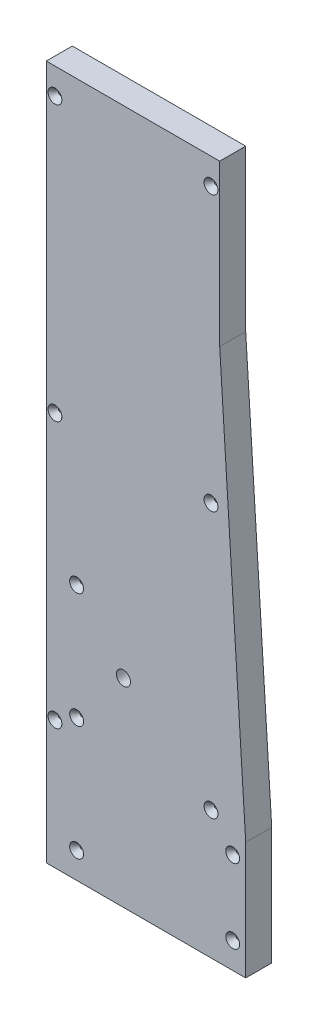
from build123d import *

# Parameters (mm, degrees)
BOSS_EXTRUDE1_DEPTH     = 19.05
F_3_8_CLEARANCE_HOLE1_D = 10.31748
HOLE1_D                 = 3.175
HOLE1_DEPTH             = 50.8
HOLE1_CSINK_D           = 10.16
HOLE1_CSINK_ANGLE       = 82
HOLE1_TIP               = 0.953866233


with BuildPart() as part:
    # Sketch1 → Boss-Extrude1 (new body)
    with BuildSketch(Plane.XY):
        Polygon((82.03946, -5024.878404071), (82.03946, -5533.415502988), (228.088766336, -5533.415502988), (228.088766336, -5447.34166837), (209.03946, -5142.552766987), (209.03946, -5024.878404071), align=None)
    extrude(amount=BOSS_EXTRUDE1_DEPTH)

    # 3/8 Clearance Hole1 (through all)
    with Locations(Plane.XY.offset(19.05)):
        with Locations((138.550999994, -5387.96381451)):
            Hole(F_3_8_CLEARANCE_HOLE1_D / 2)

    # Hole1
    with Locations(Plane(origin=(0, -5562.870276207, 19.05), x_dir=(1, 0, 0), z_dir=(0, 0, 1))):
        with Locations((218.563766336, 102.817509219), (218.563766336, 48.504773219), (202.68946, 123.306744588), (202.68946, 317.949308361), (202.68946, 518.941872135), (88.38946, 518.941872135), (88.38946, 317.949308361), (88.38946, 123.306744588), (104.263766336, 216.849631358), (104.263766336, 132.677202288), (104.263766336, 48.504773219), (-104.263766336, 48.504773219), (-104.263766336, 132.677202288), (-104.263766336, 216.849631358), (-88.38946, 123.306744588), (-88.38946, 317.949308361), (-88.38946, 518.941872135), (-202.68946, 518.941872135), (-202.68946, 317.949308361), (-202.68946, 123.306744588), (-218.563766336, 48.504773219), (-218.563766336, 102.817509219)):
            CounterSinkHole(HOLE1_D / 2, HOLE1_CSINK_D / 2, depth=HOLE1_DEPTH, counter_sink_angle=HOLE1_CSINK_ANGLE)
            with Locations((0, 0, -(HOLE1_DEPTH + HOLE1_TIP / 2))):  # 118° drill point
                Cone(0, HOLE1_D / 2, HOLE1_TIP, mode=Mode.SUBTRACT)


solid = part.part
